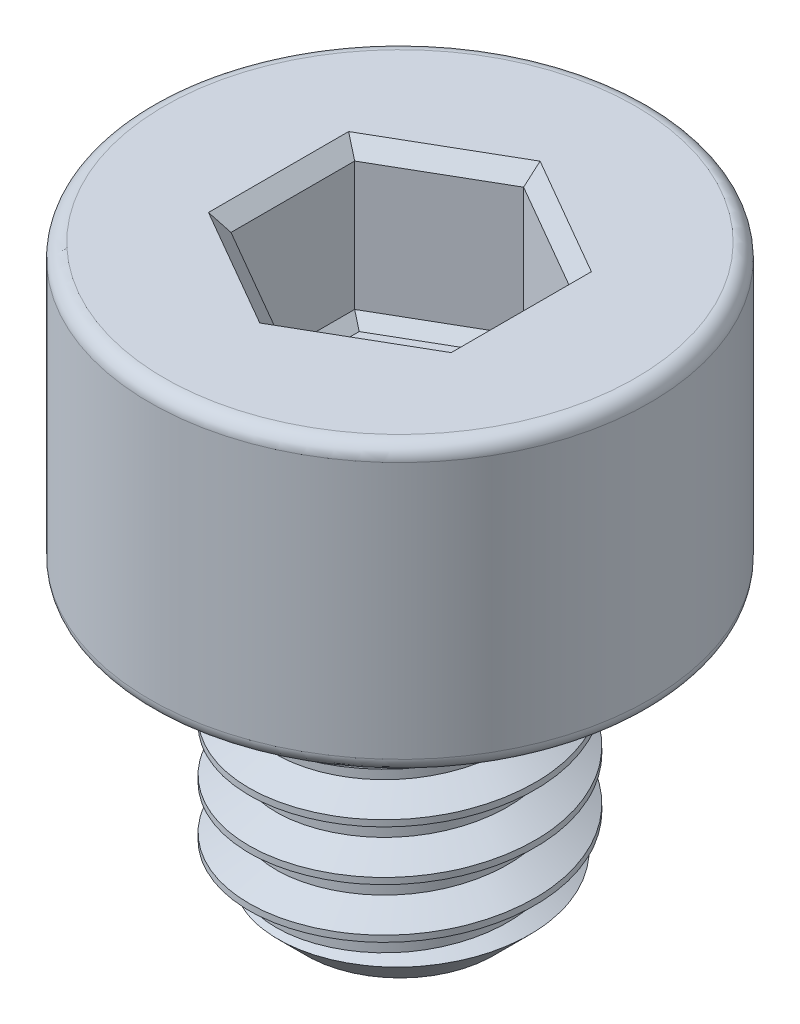
from build123d import *

# Parameters (mm, degrees)
SKETCH1_R           = 2
BOSS_EXTRUDE1_DEPTH = 4
THREAD1_PITCH       = 0.7
SKETCH4_R           = 3.5
BOSS_EXTRUDE2_DEPTH = 4
FILLET1_R           = 0.2
CUT_EXTRUDE1_DEPTH  = 2
CHAMFER1_SIZE       = 0.2
CUT_EXTRUDE2_DEPTH  = 0.15
CUT_EXTRUDE2_DRAFT  = -45


with BuildPart() as part:
    # Sketch1 → Boss-Extrude1 (new body)
    with BuildSketch(Plane(origin=(0, 0, 0), x_dir=(1, 0, 0), z_dir=(0, 1, 0))):
        with Locations(Location((0, 0, 0), (0, 0, 270))):
            Circle(SKETCH1_R)
    extrude(amount=BOSS_EXTRUDE1_DEPTH)

    # Thread1: the profile of Thread Profile1 profile screwed along a right-hand helix of 7.142857 turns, 6 arcs to a turn; built about Z, then put on its axis
    thread1_z = Axis((0, 0, 0), (0, 0, 1))
    thread1_corners = [(2.0003, 0, -0.000173205), (2.0003, 0, 0.612673203), (1.621113887, 0, 0.393749999), (1.621113887, 0, 0.218749999)]
    with BuildLine(mode=Mode.PRIVATE) as thread1_profile:
        Line(thread1_corners[0], thread1_corners[1])
        Line(thread1_corners[1], thread1_corners[2])
        Line(thread1_corners[2], thread1_corners[3])
        Line(thread1_corners[3], thread1_corners[0])
    thread1_cap = Face(thread1_profile.wire())
    thread1_turn_angles = [0, 30, 60, 90, 120, 150, 180, 210, 240, 270, 300, 330, 360]
    thread1_turn_weights = [1, 0.8660254037844387, 1, 0.8660254037844387, 1, 0.8660254037844387, 1, 0.8660254037844387, 1, 0.8660254037844387, 1, 0.8660254037844387, 1]
    thread1_turn_rails = [Edge.make_bspline([Vector(p[0], p[1], 0).rotate(thread1_z, thread1_turn_angles[k]) / thread1_turn_weights[k] + Vector(0, 0, p[2] + THREAD1_PITCH * thread1_turn_angles[k] / 360) for k in range(13)], [0, 0, 0, 1, 1, 2, 2, 3, 3, 4, 4, 5, 5, 6, 6, 6], 2, thread1_turn_weights) for p in thread1_corners]
    thread1_turn_sides = [Face.make_surface_from_curves(thread1_turn_rails[p[0]], thread1_turn_rails[p[1]]) for p in [(0, 1), (1, 2), (2, 3), (3, 0)]]
    thread1_last_angles = [2520, 2545.714285714, 2571.428571429]
    thread1_last_weights = [1, 0.9009688679024186, 1]
    thread1_last_rails = [Edge.make_bspline([Vector(p[0], p[1], 0).rotate(thread1_z, thread1_last_angles[k]) / thread1_last_weights[k] + Vector(0, 0, p[2] + THREAD1_PITCH * thread1_last_angles[k] / 360) for k in range(3)], [0, 0, 0, 1, 1, 1], 2, thread1_last_weights) for p in thread1_corners]
    thread1_last_sides = [Face.make_surface_from_curves(thread1_last_rails[p[0]], thread1_last_rails[p[1]]) for p in [(0, 1), (1, 2), (2, 3), (3, 0)]]
    thread1 = Plane(origin=(0, -1, 0), x_dir=(1, 0, 0), z_dir=(0, 1, 0)) * Solid(Shell([*[p.moved(Location((0, 0, THREAD1_PITCH * i))) for i in range(7) for p in thread1_turn_sides], *thread1_last_sides, thread1_cap, thread1_cap.rotate(thread1_z, 2571.428571429).moved(Location((0, 0, THREAD1_PITCH * 2571.428571429 / 360)))]))
    add(thread1, mode=Mode.SUBTRACT)

    # Sketch4 → Boss-Extrude2 (add)
    with BuildSketch(Plane(origin=(0, 4, 0), x_dir=(-1, 0, 0), z_dir=(0, -1, 0))):
        with Locations(Location((0, 0, 0), (0, 0, 90))):
            Circle(SKETCH4_R)
    extrude(amount=-BOSS_EXTRUDE2_DEPTH)

    # Fillet1
    fillet1_edges = [part.edges().sort_by_distance(p)[0] for p in [
        (0, 4, 3.5),
        (0, 8, 3.5),
    ]]
    fillet(fillet1_edges, radius=FILLET1_R)

    # Sketch6 → Cut-Revolve1 (revolve, cut)
    with BuildSketch(Plane.XY, mode=Mode.PRIVATE) as cut_revolve1_sk:
        Polygon((2.01, 0), (2.01, 0.7), (1.31, 0), align=None)
    revolve(cut_revolve1_sk.sketch.rotate(Axis((0, 0, 0), (0, 1, 0)), 202.132599438), axis=Axis((0, 0, 0), (0, 1, 0)), mode=Mode.SUBTRACT)

    # Sketch7 → Cut-Extrude1 (cut)
    with BuildSketch(Plane(origin=(0, 8, 0), x_dir=(1, 0, 0), z_dir=(0, 1, 0))):
        Polygon((0, 1.732050808), (-1.5, 0.866025404), (-1.5, -0.866025404), (0, -1.732050808), (1.5, -0.866025404), (1.5, 0.866025404), align=None)
    extrude(amount=-CUT_EXTRUDE1_DEPTH, mode=Mode.SUBTRACT)

    # Chamfer1
    chamfer1_edges = [part.edges().sort_by_distance(p)[0] for p in [
        (0.75, 8, -1.299038106),
        (-0.75, 8, -1.299038106),
        (-1.5, 8, 0),
        (-0.75, 8, 1.299038106),
        (0.75, 8, 1.299038106),
        (1.5, 8, 0),
    ]]
    chamfer(chamfer1_edges, length=CHAMFER1_SIZE)


with BuildPart() as cut_extrude2_tool:
    # Sketch8 → Cut-Extrude2 (with draft: the straight prism first)
    with BuildSketch(Plane(origin=(0, 6, 0), x_dir=(1, 0, 0), z_dir=(0, 1, 0))):
        Polygon((0, 1.732050808), (-1.5, 0.866025404), (-1.5, -0.866025404), (0, -1.732050808), (1.5, -0.866025404), (1.5, 0.866025404), align=None)
    extrude(amount=-CUT_EXTRUDE2_DEPTH)
    # Cut-Extrude2: the draft: its side faces are tilted about the plane it starts from
    cut_extrude2_sides = [cut_extrude2_tool.faces().sort_by_distance(p)[0] for p in [
        (-0.75, 5.925, -1.299038106),
        (-1.5, 5.925, 0),
        (-0.75, 5.925, 1.299038106),
        (0.75, 5.925, 1.299038106),
        (1.5, 5.925, 0),
        (0.75, 5.925, -1.299038106),
    ]]
    draft(cut_extrude2_sides, Plane(origin=(0, 6, 0), x_dir=(1, 0, 0), z_dir=(0, 1, 0)), CUT_EXTRUDE2_DRAFT)


with BuildPart() as part_1:
    add(part.part)

    # Cut-Extrude2: cut by cut_extrude2_tool
    add(cut_extrude2_tool.part, mode=Mode.SUBTRACT)


solid = part_1.part
